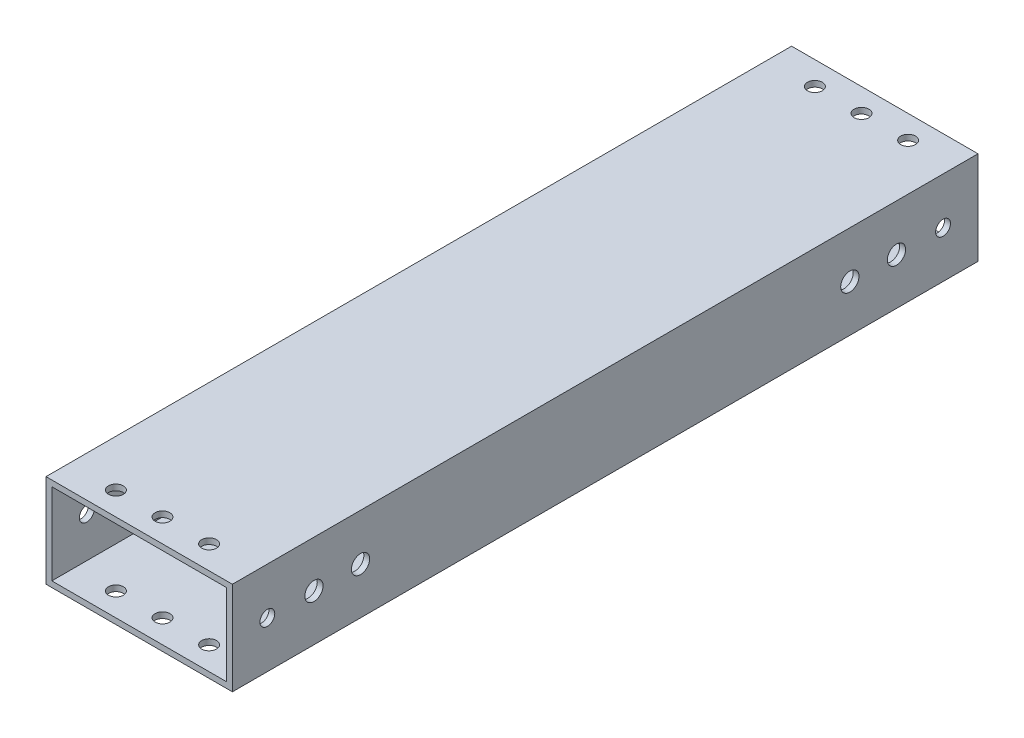
from build123d import *

# Parameters (mm, degrees)
SKETCH1_W           = 50.8
SKETCH1_H           = 25.4
SKETCH1_W_2         = 47.625
SKETCH1_H_2         = 22.225
BOSS_EXTRUDE1_DEPTH = 101.6
SKETCH2_R           = 2.0193
SKETCH2_R_2         = 2.4892
CUT_EXTRUDE1_DEPTH  = 115.3
SKETCH3_R           = 2.0193
CUT_EXTRUDE2_DEPTH  = 108.763073453


with BuildPart() as part:
    # Sketch1 → Boss-Extrude1 (new, symmetric)
    with BuildSketch(Plane.XY):
        Rectangle(SKETCH1_W, SKETCH1_H)
        Rectangle(SKETCH1_W_2, SKETCH1_H_2, mode=Mode.SUBTRACT)
    extrude(amount=BOSS_EXTRUDE1_DEPTH, both=True)

    # Sketch2 → Cut-Extrude1 (cut, through all)
    with BuildSketch(Plane(origin=(25.4, 0, 0), x_dir=(0, 0, -1), z_dir=(1, 0, 0))):
        with Locations((-92.075, 0)):
            Circle(SKETCH2_R)
        with Locations((92.075, 0)):
            Circle(SKETCH2_R)
        with Locations((-79.375, 0)):
            Circle(SKETCH2_R_2)
        with Locations((-66.675, 0)):
            Circle(SKETCH2_R_2)
        with Locations((66.675, 0)):
            Circle(SKETCH2_R_2)
        with Locations((79.375, 0)):
            Circle(SKETCH2_R_2)
    extrude(amount=-CUT_EXTRUDE1_DEPTH, mode=Mode.SUBTRACT)

    # Sketch3 → Cut-Extrude2 (cut, through all)
    with BuildSketch(Plane(origin=(0, 12.7, 0), x_dir=(1, 0, 0), z_dir=(0, 1, 0))):
        with Locations((-12.7, -95.25)):
            Circle(SKETCH3_R)
        with Locations((0, -95.25)):
            Circle(SKETCH3_R)
        with Locations((12.7, -95.25)):
            Circle(SKETCH3_R)
        with Locations((12.7, 95.25)):
            Circle(SKETCH3_R)
        with Locations((0, 95.25)):
            Circle(SKETCH3_R)
        with Locations((-12.7, 95.25)):
            Circle(SKETCH3_R)
    extrude(amount=-CUT_EXTRUDE2_DEPTH, mode=Mode.SUBTRACT)


solid = part.part
